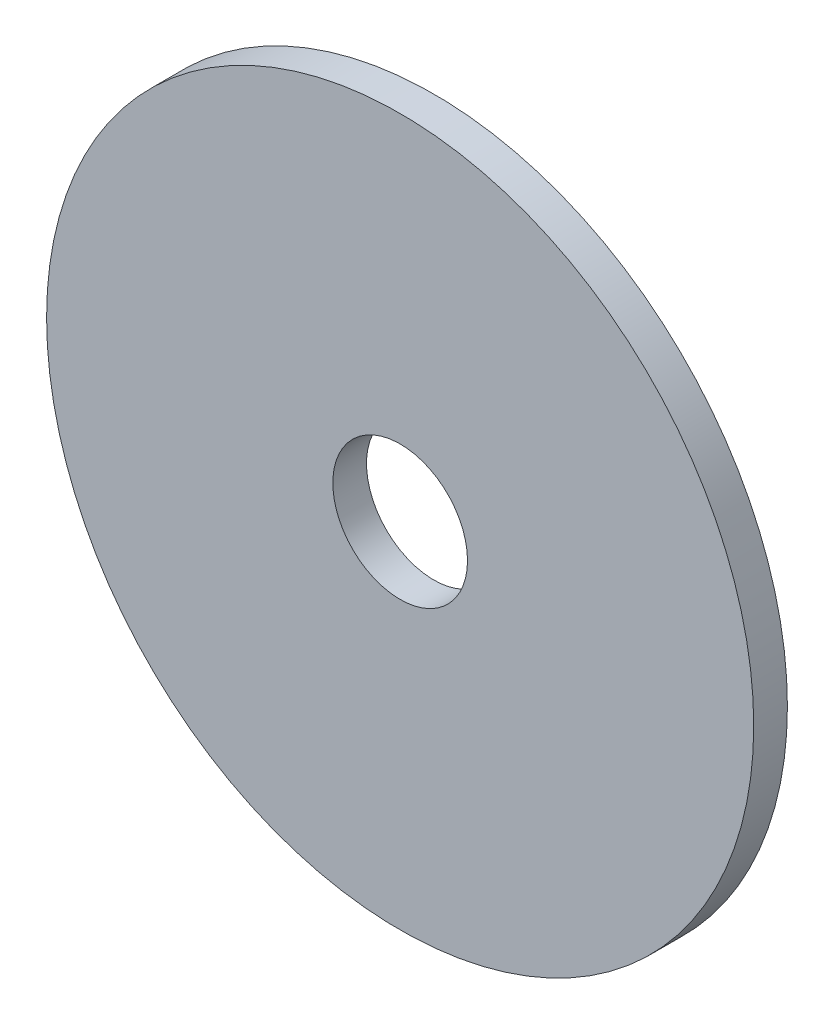
from build123d import *

# Parameters (mm, degrees)
SKETCH1_R           = 52.5
SKETCH1_R_2         = 10
BOSS_EXTRUDE2_DEPTH = 5


with BuildPart() as part:
    # Sketch1 → Boss-Extrude2 (new body)
    with BuildSketch(Plane.XY):
        Circle(SKETCH1_R)
        Circle(SKETCH1_R_2, mode=Mode.SUBTRACT)
    extrude(amount=-BOSS_EXTRUDE2_DEPTH)


solid = part.part
